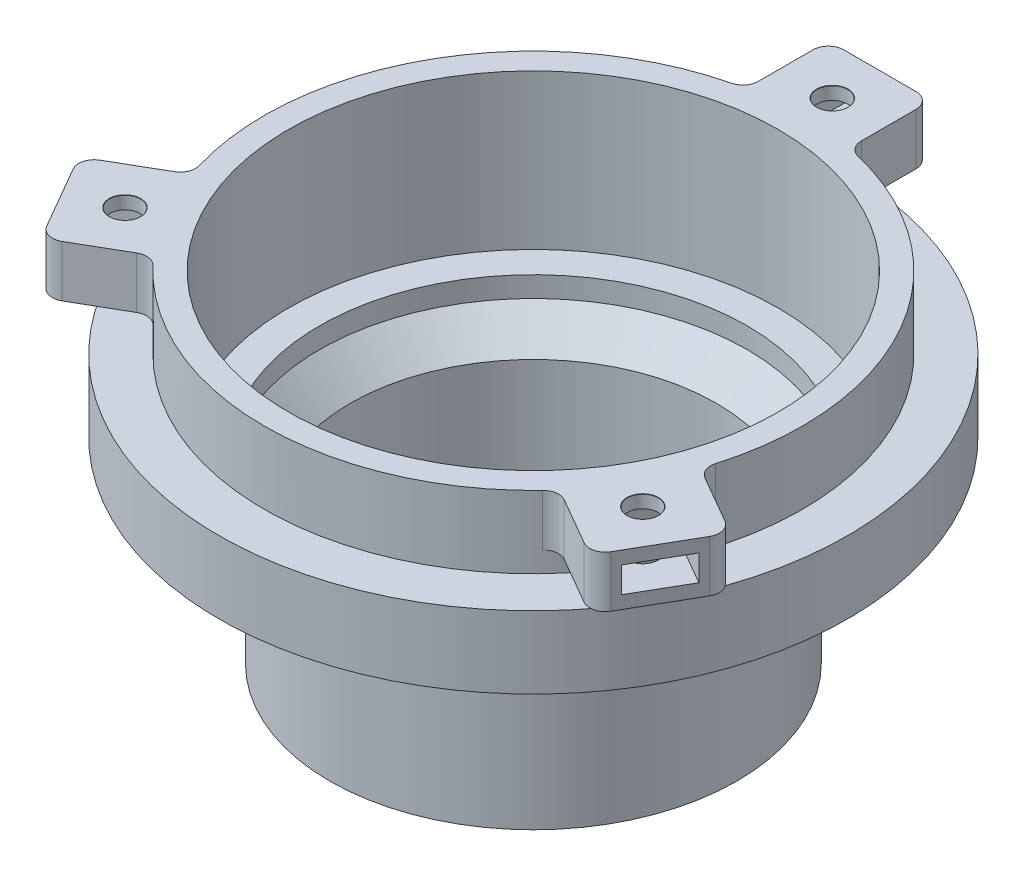
from build123d import *

# Parameters (mm, degrees)
SKETCH2_W                        = 10
SKETCH2_H                        = 8
BOSS_EXTRUDE1_DEPTH              = 5
F_3_0_MM_DOWEL_HOLES2_AT_2_COUNT = 2
F_3_0_MM_DOWEL_HOLES2_AT_2_PITCH = 50.229473419
F_3_0_MM_DOWEL_HOLES2_AT_3_COUNT = 2
F_3_0_MM_DOWEL_HOLES2_AT_3_PITCH = 50.229473419
SKETCH7_W                        = 5.5
SKETCH7_H                        = 2.5
CUT_EXTRUDE2_DEPTH               = 7
CIRPATTERN1_COUNT                = 3
FILLET1_R                        = 1.5


with BuildPart() as part:
    # Sketch1 → Revolve1 (revolve)
    with BuildSketch(Plane.XY):
        Polygon((17.75, 0), (17.75, 13), (20.75, 16), (20.75, 18), (23.75, 18), (23.75, 33), (26.1, 33), (26.1, 26), (30.5, 26), (30.5, 19), (28.5, 19), (28.5, 24), (26.1, 24), (26.1, 16), (22.75, 16), (22.75, 15.171572875), (19.75, 12.171572875), (19.75, 0), align=None)
    revolve(axis=Axis((0, -2.236337236, 0), (0, 1, 0)))

    # Sketch2 → Boss-Extrude1 (add)
    with BuildSketch(Plane(origin=(0, 33, 0), x_dir=(1, 0, 0), z_dir=(0, 1, 0))):
        with Locations((0, 29.616596183)):
            Rectangle(SKETCH2_W, SKETCH2_H)
    boss_extrude1 = extrude(amount=-BOSS_EXTRUDE1_DEPTH)

    # Sketch4 → Ø3.0 mm Dowel Holes2 (revolve, cut)
    with BuildSketch(Plane(origin=(0, 33, -29), x_dir=(0, 0, 1), z_dir=(1, 0, 0))):
        Polygon((0, 0), (0, 5.901290929), (1.5, 5), (1.5, 0.025), (1.525, 0), align=None)
    f_3_0_mm_dowel_holes2 = revolve(axis=Axis((0, 39.35, -29), (0, -1, 0)), mode=Mode.SUBTRACT)

    # Ø3.0 mm Dowel Holes2 at 2: Ø3.0 mm Dowel Holes2 ×2
    with Locations(*[Vector(-0.4999999999999979, 0, 0.8660254037844399) * (i * F_3_0_MM_DOWEL_HOLES2_AT_2_PITCH) for i in range(1, F_3_0_MM_DOWEL_HOLES2_AT_2_COUNT)]):
        add(f_3_0_mm_dowel_holes2, mode=Mode.SUBTRACT)

    # Ø3.0 mm Dowel Holes2 at 3: Ø3.0 mm Dowel Holes2 ×2
    with Locations(*[Vector(0.49999999999999806, 0, 0.8660254037844398) * (i * F_3_0_MM_DOWEL_HOLES2_AT_3_PITCH) for i in range(1, F_3_0_MM_DOWEL_HOLES2_AT_3_COUNT)]):
        add(f_3_0_mm_dowel_holes2, mode=Mode.SUBTRACT)

    # Sketch7 → Cut-Extrude2 (cut)
    with BuildSketch(Plane(origin=(0, 0, -33.616596183), x_dir=(-1, 0, 0), z_dir=(0, 0, -1))):
        with Locations((0, 30.5)):
            Rectangle(SKETCH7_W, SKETCH7_H)
    cut_extrude2 = extrude(amount=-CUT_EXTRUDE2_DEPTH, mode=Mode.SUBTRACT)

    # CirPattern1: Boss-Extrude1, Ø3.0 mm Dowel Holes2, Cut-Extrude2 ×3 about axis
    cirpattern1_axis = Axis((0, -2.236337236, 0), (0, -1, 0))
    add([boss_extrude1.rotate(cirpattern1_axis, i * 360 / CIRPATTERN1_COUNT) for i in range(1, CIRPATTERN1_COUNT)])
    add([f_3_0_mm_dowel_holes2.rotate(cirpattern1_axis, i * 360 / CIRPATTERN1_COUNT) for i in range(1, CIRPATTERN1_COUNT)], mode=Mode.SUBTRACT)
    add([cut_extrude2.rotate(cirpattern1_axis, i * 360 / CIRPATTERN1_COUNT) for i in range(1, CIRPATTERN1_COUNT)], mode=Mode.SUBTRACT)

    # CirPattern1 copy 1 sketch → CirPattern1 copy 1 (revolve, cut)
    with BuildSketch(Plane(origin=(0, 33, -29), x_dir=(-0.8660254037844387, 0, -0.4999999999999998), z_dir=(-0.4999999999999998, 0, 0.8660254037844387))):
        Polygon((0, 0), (0, 5.901290929), (1.5, 5), (1.5, 0.025), (1.525, 0), align=None)
    revolve(axis=Axis((0, 39.35, -29), (0, -1, 0)), mode=Mode.SUBTRACT)

    # CirPattern1 copy 2 sketch → CirPattern1 copy 2 (revolve, cut)
    with BuildSketch(Plane(origin=(25.11473671, 33, 14.5), x_dir=(0.8660254037844384, 0, -0.5000000000000004), z_dir=(-0.5000000000000004, 0, -0.8660254037844384))):
        Polygon((0, 0), (0, 5.901290929), (1.5, 5), (1.5, 0.025), (1.525, 0), align=None)
    revolve(axis=Axis((25.11473671, 39.35, 14.5), (0, -1, 0)), mode=Mode.SUBTRACT)

    # CirPattern1 copy 3 sketch → CirPattern1 copy 3 (revolve, cut)
    with BuildSketch(Plane(origin=(-25.11473671, 33, 14.5), x_dir=(-0.8660254037844387, 0, -0.4999999999999998), z_dir=(-0.4999999999999998, 0, 0.8660254037844387))):
        Polygon((0, 0), (0, 5.901290929), (1.5, 5), (1.5, 0.025), (1.525, 0), align=None)
    revolve(axis=Axis((-25.11473671, 39.35, 14.5), (0, -1, 0)), mode=Mode.SUBTRACT)

    # CirPattern1 copy 4 sketch → CirPattern1 copy 4 (revolve, cut)
    with BuildSketch(Plane(origin=(0, 33, -29), x_dir=(0.8660254037844384, 0, -0.5000000000000004), z_dir=(-0.5000000000000004, 0, -0.8660254037844384))):
        Polygon((0, 0), (0, 5.901290929), (1.5, 5), (1.5, 0.025), (1.525, 0), align=None)
    revolve(axis=Axis((0, 39.35, -29), (0, -1, 0)), mode=Mode.SUBTRACT)

    # Fillet1
    fillet1_edges = [part.edges().sort_by_distance(p)[0] for p in [
        (-5, 30.5, -25.616596183),
        (-5, 30.5, -33.616596183),
        (5, 30.5, -33.616596183),
        (5, 30.5, -25.616596183),
        (24.684623053, 30.5, 8.478171073),
        (31.612826283, 30.5, 12.478171073),
        (19.684623053, 30.5, 17.13842511),
        (-19.684623053, 30.5, 17.13842511),
        (-26.612826283, 30.5, 21.13842511),
        (-31.612826283, 30.5, 12.478171073),
        (-24.684623053, 30.5, 8.478171073),
        (26.612826283, 30.5, 21.13842511),
    ]]
    fillet(fillet1_edges, radius=FILLET1_R)


solid = part.part
